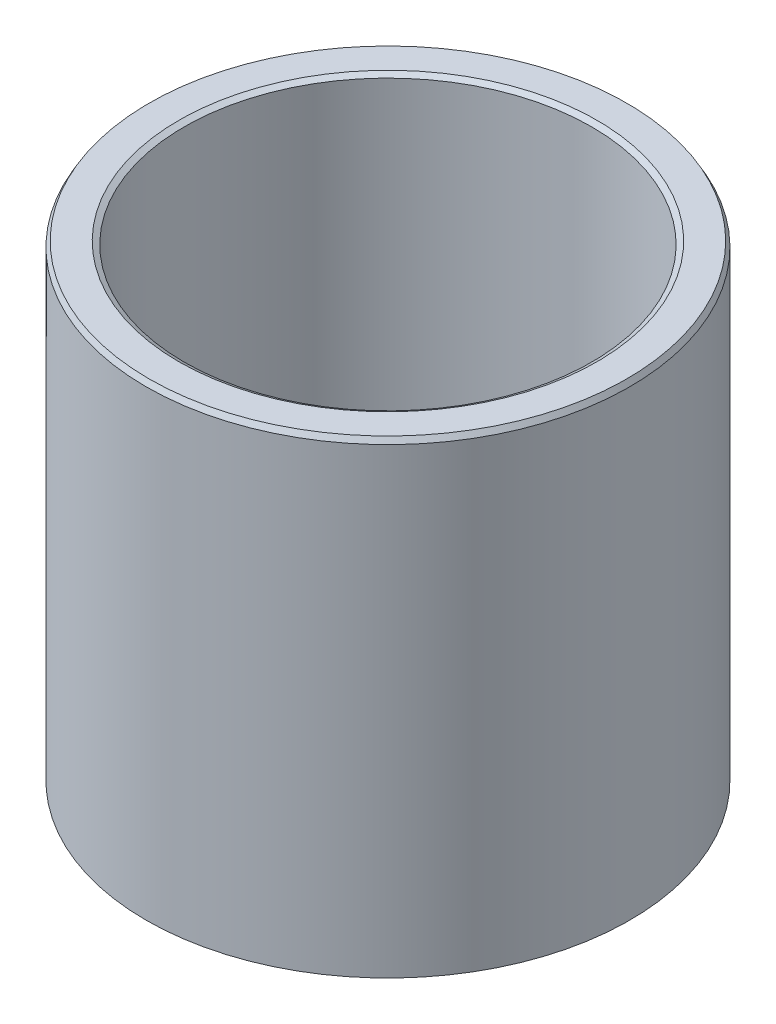
from build123d import *
from OCP.BRepFilletAPI import BRepFilletAPI_MakeChamfer

# Parameters (mm, degrees)
SKETCH1_R           = 42.5
BOSS_EXTRUDE1_DEPTH = 82.649019408
SKETCH2_R           = 35.812112591
CUT_EXTRUDE1_DEPTH  = 103.19276104
CHAMFER1_SIZE       = 0.936653579
CHAMFER1_SIZE2      = 0.527436923


with BuildPart() as part:
    # Sketch1 → Boss-Extrude1 (new body)
    with BuildSketch(Plane(origin=(0, 0, 0), x_dir=(1, 0, 0), z_dir=(0, 1, 0))):
        Circle(SKETCH1_R)
    extrude(amount=BOSS_EXTRUDE1_DEPTH)

    # Sketch2 → Cut-Extrude1 (cut, through all)
    with BuildSketch(Plane(origin=(0, 0, 0), x_dir=(1, 0, 0), z_dir=(0, 1, 0))):
        Circle(SKETCH2_R)
    extrude(amount=CUT_EXTRUDE1_DEPTH, mode=Mode.SUBTRACT)

    # Chamfer1: one chamfer whose edges measure the first distance from different faces: ONE call of the kernel's chamfer builder (chamfer() names one face for all edges)
    chamfer1_edges_1 = [part.edges().sort_by_distance(p)[0] for p in [
        (-35.812112591, 82.649019408, 0),
    ]]
    chamfer1_side_1 = [part.faces().sort_by_distance(p)[0] for p in [
        (-41.297918472, 82.649019408, 0),
    ]]
    chamfer1_edges_2 = [part.edges().sort_by_distance(p)[0] for p in [
        (-35.812112591, 0, 0),
    ]]
    chamfer1_side_2 = [part.faces().sort_by_distance(p)[0] for p in [
        (-35.812112591, 41.324509704, 0),
    ]]
    chamfer1_edges_3 = [part.edges().sort_by_distance(p)[0] for p in [
        (-42.5, 0, 0),
    ]]
    chamfer1_side_3 = [part.faces().sort_by_distance(p)[0] for p in [
        (-41.297918472, 0, 0),
    ]]
    chamfer1_edges_4 = [part.edges().sort_by_distance(p)[0] for p in [
        (-42.5, 82.649019408, 0),
    ]]
    chamfer1_side_4 = [part.faces().sort_by_distance(p)[0] for p in [
        (-42.5, 41.324509704, 0),
    ]]
    chamfer1 = BRepFilletAPI_MakeChamfer(part.part.solid().wrapped)
    for e in chamfer1_edges_1:
        chamfer1.Add(CHAMFER1_SIZE, CHAMFER1_SIZE2, e.wrapped, chamfer1_side_1[0].wrapped)  # the first distance lies on this face
    for e in chamfer1_edges_2:
        chamfer1.Add(CHAMFER1_SIZE, CHAMFER1_SIZE2, e.wrapped, chamfer1_side_2[0].wrapped)  # the first distance lies on this face
    for e in chamfer1_edges_3:
        chamfer1.Add(CHAMFER1_SIZE, CHAMFER1_SIZE2, e.wrapped, chamfer1_side_3[0].wrapped)  # the first distance lies on this face
    for e in chamfer1_edges_4:
        chamfer1.Add(CHAMFER1_SIZE, CHAMFER1_SIZE2, e.wrapped, chamfer1_side_4[0].wrapped)  # the first distance lies on this face
    add(Compound.cast(chamfer1.Shape()), mode=Mode.REPLACE)


solid = part.part
